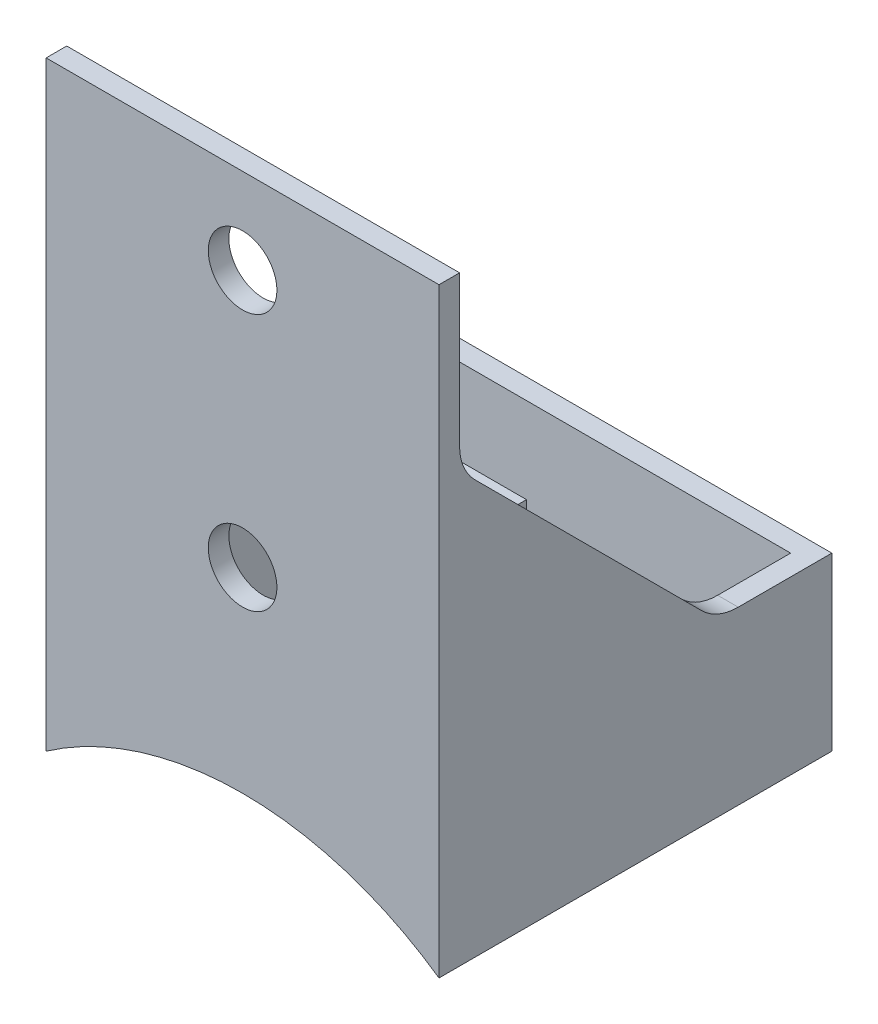
from build123d import *

# Parameters (mm, degrees)
SKETCH_1_W          = 22.9
SKETCH_1_H          = 22.9
SKETCH_1_W_2        = 20.5
SKETCH_1_H_2        = 20.5
EXTRUDE_1_DEPTH     = 10
SKETCH_1_4_R        = 1.27
EXTRUDE_2_DEPTH     = 5
EXTRUDE_3_DEPTH     = 10
SKETCH_3_W          = 22.9
SKETCH_3_H          = 1.2
EXTRUDE_4_DEPTH     = 25
CUT_EXTRUDE_1_REACH = 45.365
SKETCH_4_R          = 20
SKETCH_5_R          = 2
CUT_EXTRUDE_2_DEPTH = 43.743332891
CHAMFER_1_SIZE      = 15
FILLET_1_R          = 3


with BuildPart() as part:
    # 草图1 → 凸台-拉伸1 (new body)
    with BuildSketch(Plane(origin=(0, 0, 0), x_dir=(1, 0, 0), z_dir=(0, 1, 0))):
        Rectangle(SKETCH_1_W, SKETCH_1_H)
        Rectangle(SKETCH_1_W_2, SKETCH_1_H_2, mode=Mode.SUBTRACT)
    extrude(amount=EXTRUDE_1_DEPTH)

    # 草图1<4> → 凸台-拉伸2 (add)
    # profile 1 of 2: a face of its own
    with BuildSketch(Plane(origin=(0, 0, 0), x_dir=(1, 0, 0), z_dir=(0, 1, 0))):
        with BuildLine():
            Line((-5.15, 10.25), (-10.25, 10.25))
            Line((-10.25, 10.25), (-10.25, 5.18))
            Line((-10.25, 5.18), (-7.62, 5.18))
            ThreePointArc((-7.62, 5.18), (-5.87344625, 5.90344625), (-5.15, 7.65))
            Line((-5.15, 7.65), (-5.15, 10.25))
        make_face()
        with Locations((-7.62, 7.65)):
            Circle(SKETCH_1_4_R, mode=Mode.SUBTRACT)
    # profile 2 of 2: a face of its own
    with BuildSketch(Plane(origin=(0, 0, 0), x_dir=(1, 0, 0), z_dir=(0, 1, 0))):
        with BuildLine():
            Line((10.25, 10.25), (5.15, 10.25))
            Line((5.15, 10.25), (5.15, 7.65))
            ThreePointArc((5.15, 7.65), (5.87344625, 5.90344625), (7.62, 5.18))
            Line((7.62, 5.18), (10.25, 5.18))
            Line((10.25, 5.18), (10.25, 10.25))
        make_face()
        with Locations((7.62, 7.65)):
            Circle(SKETCH_1_4_R, mode=Mode.SUBTRACT)
    extrude(amount=EXTRUDE_2_DEPTH)

    # 草图1<5> → 凸台-拉伸3 (add)
    with BuildSketch(Plane(origin=(0, 0, 0), x_dir=(1, 0, 0), z_dir=(0, 1, 0))):
        Polygon((10.25, -10.25), (-10.25, -10.25), (-11.45, -10.25), (-11.45, -11.45), (11.45, -11.45), (11.45, -10.25), align=None)
    extrude(amount=EXTRUDE_3_DEPTH)

    # 草图3 → 凸台-拉伸4 (add)
    with BuildSketch(Plane(origin=(0, 10, 0), x_dir=(1, 0, 0), z_dir=(0, 1, 0))):
        with Locations((0, -10.85)):
            Rectangle(SKETCH_3_W, SKETCH_3_H)
    extrude(amount=EXTRUDE_4_DEPTH)

    # 草图4 → 切除-拉伸1 (cut, up to next)
    with BuildSketch(Plane(origin=(0, 0, -11.45), x_dir=(-1, 0, 0), z_dir=(0, 0, -1)), mode=Mode.PRIVATE) as cut_extrude_1_sk1:
        with Locations((0, -16.398094401)):
            Circle(SKETCH_4_R)
    cut_extrude_1_tool1 = extrude(cut_extrude_1_sk1.sketch, amount=-CUT_EXTRUDE_1_REACH, mode=Mode.PRIVATE) & part.part
    add(cut_extrude_1_tool1.solids().sort_by_distance((0, -16.398094, -11.45))[0], mode=Mode.SUBTRACT)

    # 草图5 → 切除-拉伸2 (cut, through all)
    with BuildSketch(Plane(origin=(0, 0, 10.25), x_dir=(-1, 0, 0), z_dir=(0, 0, -1))):
        with Locations((0, 15)):
            Circle(SKETCH_5_R)
        with Locations((0, 30)):
            Circle(SKETCH_5_R)
    extrude(amount=-CUT_EXTRUDE_2_DEPTH, mode=Mode.SUBTRACT)

    # 倒角1
    chamfer_1_edges = [part.edges().sort_by_distance(p)[0] for p in [
        (10.85, 10, 10.25),
        (-10.85, 10, 10.25),
    ]]
    chamfer(chamfer_1_edges, length=CHAMFER_1_SIZE)

    # 圆角1
    fillet_1_edges = [part.edges().sort_by_distance(p)[0] for p in [
        (10.85, 10, -4.75),
        (10.85, 25, 10.25),
        (-10.85, 25, 10.25),
        (-10.85, 10, -4.75),
    ]]
    fillet(fillet_1_edges, radius=FILLET_1_R)


solid = part.part
